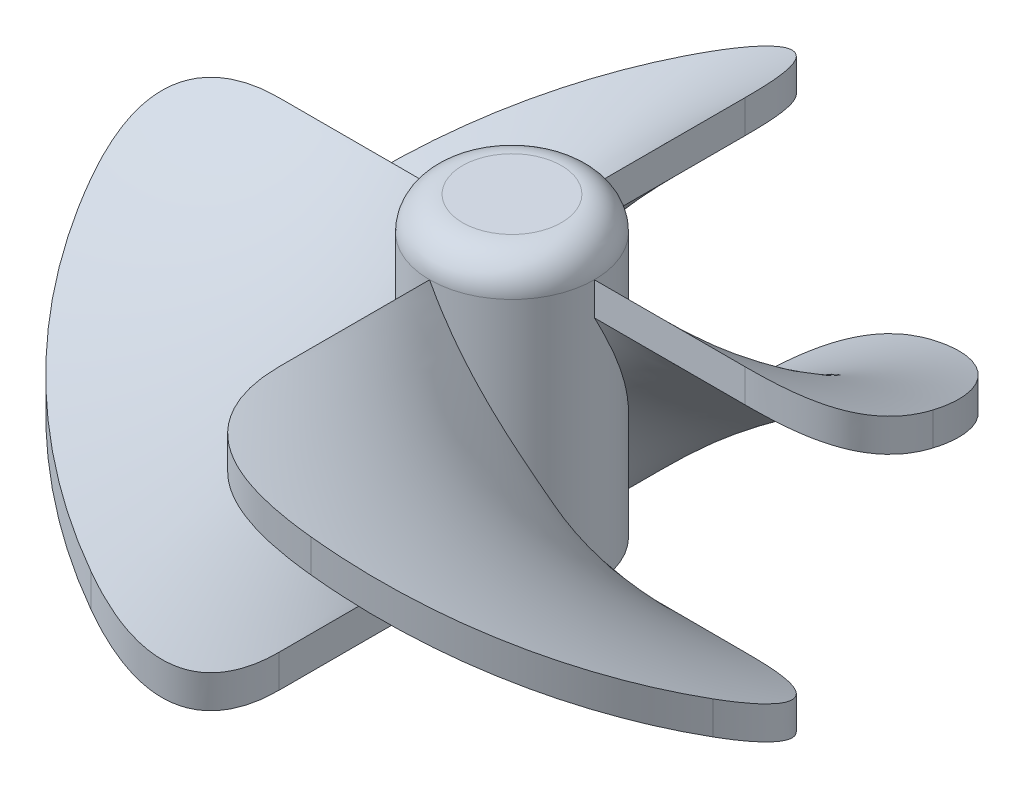
from build123d import *

# Parameters (mm, degrees)
SWEEP1_PITCH        = 76.2
SWEEP1_HEIGHT       = 19.05
SWEEP1_RADIUS       = 6.35
SWEEP1_START_ANGLE  = -90
SKETCH2_W           = 19.05
SKETCH2_H           = 2.54
SKETCH1_2_R         = 6.35
BOSS_EXTRUDE1_DEPTH = 22.86
CIRPATTERN1_COUNT   = 4
FILLET3_R           = 2.54
SKETCH3_R           = 1.016
CUT_EXTRUDE1_DEPTH  = 20.32


with BuildPart() as part:
    # Sweep1: sweep along a helix
    with BuildLine() as sweep1_path:
        add(Helix(SWEEP1_PITCH, SWEEP1_HEIGHT, SWEEP1_RADIUS, center=(0, 0, 0), direction=(0, 1, 0), lefthand=True, mode=Mode.PRIVATE).rotate(Axis((0, 0, 0), (0, 1, 0)), SWEEP1_START_ANGLE))
    # Sketch2 → Sweep1 (sweep)
    with BuildSketch(Plane.XY):
        with Locations((-15.875, 0)):
            Rectangle(SKETCH2_W, SKETCH2_H)
    sweep(path=sweep1_path.line, is_frenet=True)

    # Fillet2
    # a fillet whose section is not a circle: 6.35 mm, written as the material it takes off along each edge
    with BuildSketch(Plane(origin=(-25.4, 22.745944344, 0), x_dir=(0.16910143653286933, 0, -0.985598652678929), z_dir=(0, -1, 0))) as fillet2_piece_1:
        with BuildLine():
            Bezier((8.590377737, 0), (-0.260546372, -1.518580554), (1.258027316, 7.332344733), weights=[1, 1, 1])
            Line((1.258027316, 7.332344733), (0, 0))
            ThreePointArc((0, 0), (4.29518877, -0.36579567), (8.590377737, 0))
        make_face()
    extrude(amount=45.491888687, mode=Mode.SUBTRACT)
    with BuildSketch(Plane(origin=(2.182e-06, 41.795943163, -25.400001364), x_dir=(-0.9855986721967376, 1.0143363888004742e-08, 0.1691013227743277), z_dir=(3.7765066664414826e-14, -0.9999999999999982, 5.998416181960354e-08))) as fillet2_piece_2:
        with BuildLine():
            Bezier((8.590377722, 0), (-0.260546368, 1.518580538), (1.258027309, -7.33234473), weights=[1, 1, 1])
            Line((1.258027309, -7.33234473), (0, 0))
            ThreePointArc((0, 0), (4.295188762, 0.365795667), (8.590377722, 0))
        make_face()
    extrude(amount=45.491888612, mode=Mode.SUBTRACT)


with BuildPart() as body_2:
    # Sketch1<2> → Boss-Extrude1 (new body)
    with BuildSketch(Plane(origin=(0, 0, 0), x_dir=(1, 0, 0), z_dir=(0, 1, 0))):
        with Locations(Location((0, 0, 0), (0, 0, 270))):
            Circle(SKETCH1_2_R)
    extrude(amount=BOSS_EXTRUDE1_DEPTH)

    # Fillet3
    fillet3_edges = [body_2.edges().sort_by_distance(p)[0] for p in [
        (0, 22.86, -6.35),
    ]]
    fillet(fillet3_edges, radius=FILLET3_R)

    # Sketch3 → Cut-Extrude1 (cut)
    with BuildSketch(Plane.XZ):
        with Locations(Location((0, 0, 0), (0, 0, 270))):
            Circle(SKETCH3_R)
    extrude(amount=-CUT_EXTRUDE1_DEPTH, mode=Mode.SUBTRACT)


with BuildPart() as cirpattern1_1:
    # CirPattern1: pattern copy
    add(part.part.rotate(Axis((0, 22.86, 0), (0, -1, 0)), 1 * 360 / CIRPATTERN1_COUNT))


with BuildPart() as cirpattern1_2:
    # CirPattern1: pattern copy
    add(part.part.rotate(Axis((0, 22.86, 0), (0, -1, 0)), 2 * 360 / CIRPATTERN1_COUNT))


with BuildPart() as cirpattern1_3:
    # CirPattern1: pattern copy
    add(part.part.rotate(Axis((0, 22.86, 0), (0, -1, 0)), 3 * 360 / CIRPATTERN1_COUNT))


solid = Compound([part.part, body_2.part, cirpattern1_1.part, cirpattern1_2.part, cirpattern1_3.part])
